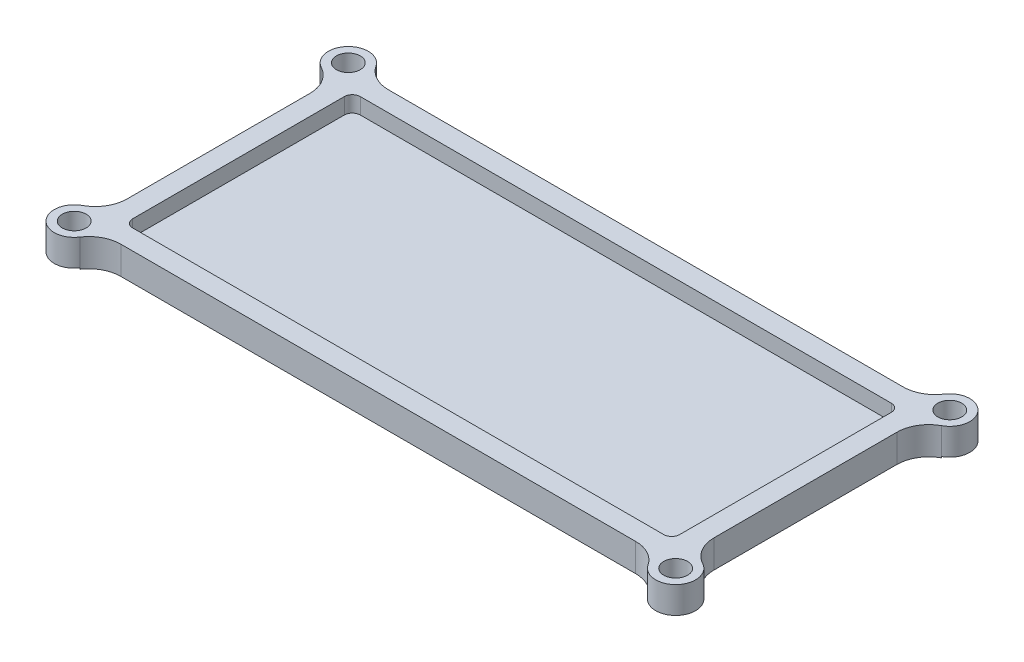
from build123d import *

# Parameters (mm, degrees)
SKETCH1_R                                      = 1
BOSS_EXTRUDE1_DEPTH                            = 1.5
SKETCH2_R                                      = 1
SKETCH2_W                                      = 68.5
SKETCH2_H                                      = 28.5
BOSS_EXTRUDE2_DEPTH                            = 2
FILLET1_R                                      = 4
CSK_FOR_M2_5_FLAT_HEAD_MACHINE_SCREW1_AT_COUNT = 2
CSK_FOR_M2_5_FLAT_HEAD_MACHINE_SCREW1_AT_PITCH = 34.329470958
CSK_FOR_M2_5_FLAT_HEAD_MACHINE_SCREW_2_COUNT   = 2
CSK_FOR_M2_5_FLAT_HEAD_MACHINE_SCREW_2_PITCH   = 75.319884043
CSK_FOR_M2_5_FLAT_HEAD_MACHINE_SCREW_3_COUNT   = 2
CSK_FOR_M2_5_FLAT_HEAD_MACHINE_SCREW_3_PITCH   = 82.774377125
FILLET2_R                                      = 1


with BuildPart() as part:
    # Sketch1 → Boss-Extrude1 (new body)
    with BuildSketch(Plane(origin=(0, 0, 0), x_dir=(1, 0, 0), z_dir=(0, 1, 0))):
        with BuildLine():
            Line((36.75, -14.836215452), (36.75, 14.836215452))
            ThreePointArc((36.75, 14.836215452), (39.599995344, 18.741502141), (35.194583126, 16.75))
            Line((35.194583126, 16.75), (-35.194583126, 16.75))
            ThreePointArc((-35.194583126, 16.75), (-39.599995344, 18.741502141), (-36.75, 14.836215452))
            Line((-36.75, 14.836215452), (-36.75, -14.836215452))
            ThreePointArc((-36.75, -14.836215452), (-39.599995344, -18.741502141), (-35.194583126, -16.75))
            Line((-35.194583126, -16.75), (35.194583126, -16.75))
            ThreePointArc((35.194583126, -16.75), (39.599995344, -18.741502141), (36.75, -14.836215452))
        make_face()
        with Locations((37.659942021, 17.164735479)):
            Circle(SKETCH1_R, mode=Mode.SUBTRACT)
        with Locations((37.659942021, -17.164735479)):
            Circle(SKETCH1_R, mode=Mode.SUBTRACT)
        with Locations((-37.659942021, -17.164735479)):
            Circle(SKETCH1_R, mode=Mode.SUBTRACT)
        with Locations((-37.659942021, 17.164735479)):
            Circle(SKETCH1_R, mode=Mode.SUBTRACT)
    extrude(amount=BOSS_EXTRUDE1_DEPTH)

    # Sketch2 → Boss-Extrude2 (add)
    with BuildSketch(Plane(origin=(0, 1.5, 0), x_dir=(1, 0, 0), z_dir=(0, 1, 0))):
        with BuildLine():
            Line((36.75, -14.836215452), (36.75, 14.836215452))
            ThreePointArc((36.75, 14.836215452), (39.599995344, 18.741502141), (35.194583126, 16.75))
            Line((35.194583126, 16.75), (-35.194583126, 16.75))
            ThreePointArc((-35.194583126, 16.75), (-39.599995344, 18.741502141), (-36.75, 14.836215452))
            Line((-36.75, 14.836215452), (-36.75, -14.836215452))
            ThreePointArc((-36.75, -14.836215452), (-39.599995344, -18.741502141), (-35.194583126, -16.75))
            Line((-35.194583126, -16.75), (35.194583126, -16.75))
            ThreePointArc((35.194583126, -16.75), (39.599995344, -18.741502141), (36.75, -14.836215452))
        make_face()
        with Locations((37.659942021, -17.164735479)):
            Circle(SKETCH2_R, mode=Mode.SUBTRACT)
        with Locations((37.659942021, 17.164735479)):
            Circle(SKETCH2_R, mode=Mode.SUBTRACT)
        with Locations((-37.659942021, 17.164735479)):
            Circle(SKETCH2_R, mode=Mode.SUBTRACT)
        with Locations((-37.659942021, -17.164735479)):
            Circle(SKETCH2_R, mode=Mode.SUBTRACT)
        Rectangle(SKETCH2_W, SKETCH2_H, mode=Mode.SUBTRACT)
    extrude(amount=BOSS_EXTRUDE2_DEPTH)

    # Fillet1
    fillet1_edges = [part.edges().sort_by_distance(p)[0] for p in [
        (36.75, 1.75, -14.836215452),
        (-35.194583126, 1.75, -16.75),
        (36.75, 1.75, 14.836215452),
        (-36.75, 1.75, -14.836215452),
        (35.194583126, 1.75, -16.75),
        (-36.75, 1.75, 14.836215452),
        (35.194583126, 1.75, 16.75),
        (-35.194583126, 1.75, 16.75),
    ]]
    fillet(fillet1_edges, radius=FILLET1_R)

    # Sketch6 → CSK for M2.5 Flat Head Machine Screw1 (revolve, cut)
    with BuildSketch(Plane(origin=(-37.659942021, 0, 17.164735479), x_dir=(0, 0, -1), z_dir=(1, 0, 0))):
        Polygon((0, 0), (0, 3.5), (1.5, 3.5), (1.5, 1.15), (2.5, 0.15), (2.5, 0), align=None)
    csk_for_m2_5_flat_head_machine_screw1 = revolve(axis=Axis((-37.659942021, -6.35, 17.164735479), (0, 1, 0)), mode=Mode.SUBTRACT)

    # CSK for M2.5 Flat Head Machine Screw1 at: CSK for M2.5 Flat Head Machine Screw1 ×2
    with Locations(*[(0, 0, -i * CSK_FOR_M2_5_FLAT_HEAD_MACHINE_SCREW1_AT_PITCH) for i in range(1, CSK_FOR_M2_5_FLAT_HEAD_MACHINE_SCREW1_AT_COUNT)]):
        add(csk_for_m2_5_flat_head_machine_screw1, mode=Mode.SUBTRACT)

    # CSK for M2.5 Flat Head Machine Screw 2: CSK for M2.5 Flat Head Machine Screw1 ×2
    with Locations(*[(i * CSK_FOR_M2_5_FLAT_HEAD_MACHINE_SCREW_2_PITCH, 0, 0) for i in range(1, CSK_FOR_M2_5_FLAT_HEAD_MACHINE_SCREW_2_COUNT)]):
        add(csk_for_m2_5_flat_head_machine_screw1, mode=Mode.SUBTRACT)

    # CSK for M2.5 Flat Head Machine Screw 3: CSK for M2.5 Flat Head Machine Screw1 ×2
    with Locations(*[Vector(0.9099420214144476, 0, -0.4147354791480819) * (i * CSK_FOR_M2_5_FLAT_HEAD_MACHINE_SCREW_3_PITCH) for i in range(1, CSK_FOR_M2_5_FLAT_HEAD_MACHINE_SCREW_3_COUNT)]):
        add(csk_for_m2_5_flat_head_machine_screw1, mode=Mode.SUBTRACT)

    # Fillet2
    fillet2_edges = [part.edges().sort_by_distance(p)[0] for p in [
        (-34.25, 2.5, 14.25),
        (34.25, 2.5, 14.25),
        (-34.25, 2.5, -14.25),
        (34.25, 2.5, -14.25),
    ]]
    fillet(fillet2_edges, radius=FILLET2_R)


solid = part.part
